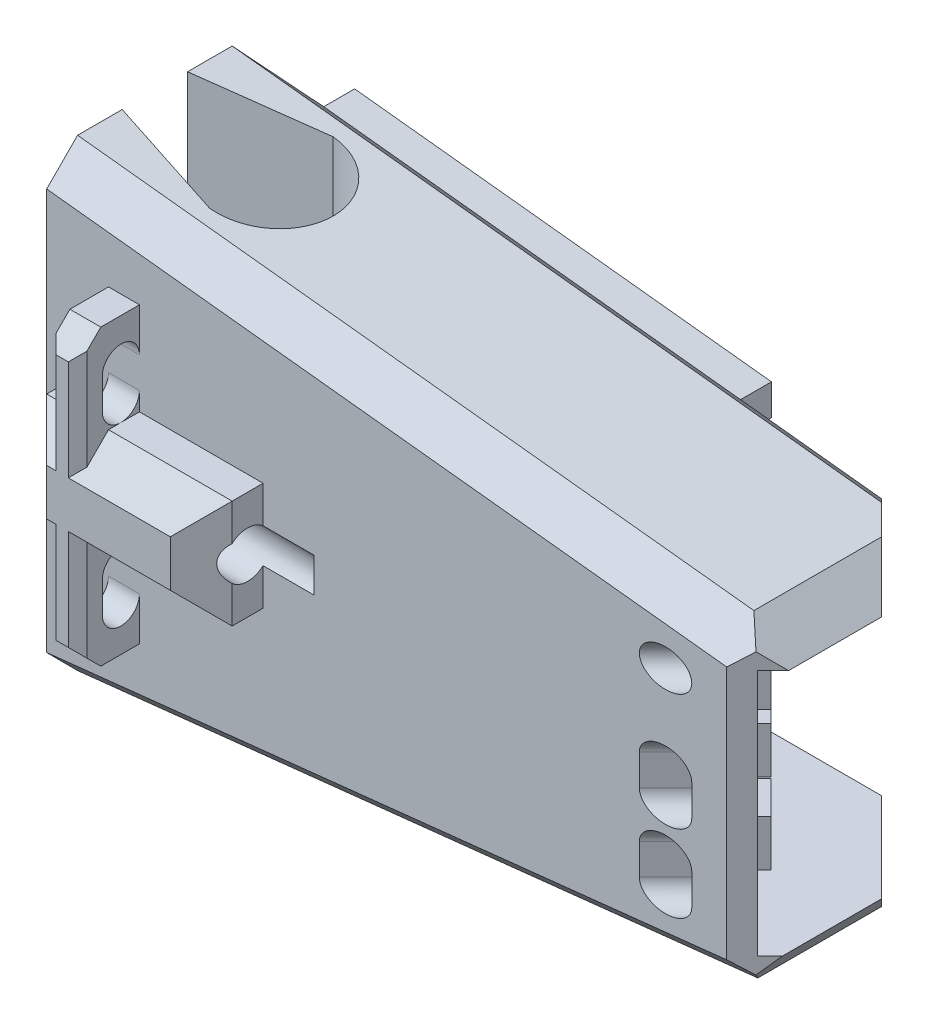
from build123d import *

# Parameters (mm, degrees)
BOSS_EXTRUDE1_DEPTH      = 7
CHAMFER1_SIZE            = 1
CHAMFER7_SIZE            = 1
CHAMFER7_EDGE_2_SIZE     = 1
CHAMFER7_EDGE_2_SIZE2    = 1.128559542
CHAMFER7_EDGE_3_SIZE     = 1
CHAMFER7_EDGE_4_SIZE     = 1
CHAMFER7_EDGE_4_SIZE2    = 1.128559542
CHAMFER14_SIZE           = 1
CHAMFER14_SIZE2          = 1.962610506
SKETCH13_W               = 6
SKETCH13_H               = 3.5
BOSS_EXTRUDE4_DEPTH      = 2
CUT_EXTRUDE9_DEPTH       = 2
CUT_EXTRUDE9_DEPTH_BACK  = 7.647280269
SKETCH14_R               = 0.75
CHAMFER15_SIZE           = 1
SKETCH15_W               = 4
SKETCH15_H               = 3.5
BOSS_EXTRUDE6_DEPTH      = 2
CUT_EXTRUDE10_DEPTH      = 2
CUT_EXTRUDE10_DEPTH_BACK = 6
SKETCH18_R               = 0.75
CHAMFER16_SIZE           = 1
CUT_EXTRUDE12_START      = 3.5
CUT_EXTRUDE12_DEPTH      = 8
SKETCH23_W               = 1.5
SKETCH23_H               = 1.5
BOSS_EXTRUDE7_DEPTH      = 0.3
SKETCH30_W               = 1
SKETCH30_H               = 4
BOSS_EXTRUDE12_DEPTH     = 2
CHAMFER19_SIZE           = 0.3
CHAMFER20_SIZE           = 0.75
CUT_EXTRUDE31_DEPTH      = 1
CUT_EXTRUDE31_DEPTH_BACK = 3
SKETCH33_R               = 0.6
CUT_EXTRUDE32_DEPTH      = 1.23
CUT_EXTRUDE33_REACH      = 30.896
CUT_EXTRUDE34_DEPTH      = 10
CUT_EXTRUDE34_DEPTH_BACK = 2
BOSS_EXTRUDE13_DEPTH     = 1
CUT_EXTRUDE35_DEPTH      = 1


# Read off the part's stored shape, not the designer's step: Cut-Extrude12
with BuildPart() as part:
    # Sketch2 → Boss-Extrude1 (new body)
    with BuildSketch(Plane.XY):
        Polygon((0, 0), (0, 15), (23, 12.5), (23, 2.5), align=None)
    extrude(amount=BOSS_EXTRUDE1_DEPTH)

    # Chamfer1
    chamfer1_edges = [part.edges().sort_by_distance(p)[0] for p in [
        (11.5, 13.75, 7),
        (11.5, 1.25, 7),
        (11.5, 13.75, 0),
        (11.5, 1.25, 0),
    ]]
    chamfer(chamfer1_edges, length=CHAMFER1_SIZE)

    # Chamfer7
    chamfer7_edges = [part.edges().sort_by_distance(p)[0] for p in [
        (23, 7.5, 7),
    ]]
    chamfer(chamfer7_edges, length=CHAMFER7_SIZE)

    # Chamfer7 edge 2
    chamfer7_edge_2_edges = [part.edges().sort_by_distance(p)[0] for p in [
        (23, 2.5, 3.5),
    ]]
    chamfer7_edge_2_side = [part.faces().sort_by_distance(p)[0] for p in [
        (11.5, 1.25, 3.5),
    ]]
    chamfer(chamfer7_edge_2_edges, length=CHAMFER7_EDGE_2_SIZE, length2=CHAMFER7_EDGE_2_SIZE2, reference=chamfer7_edge_2_side[0])

    # Chamfer7 edge 3
    chamfer7_edge_3_edges = [part.edges().sort_by_distance(p)[0] for p in [
        (23, 7.5, 0),
    ]]
    chamfer(chamfer7_edge_3_edges, length=CHAMFER7_EDGE_3_SIZE)

    # Chamfer7 edge 4
    chamfer7_edge_4_edges = [part.edges().sort_by_distance(p)[0] for p in [
        (23, 12.5, 3.5),
    ]]
    chamfer7_edge_4_side = [part.faces().sort_by_distance(p)[0] for p in [
        (23, 7.5, 3.5),
    ]]
    chamfer(chamfer7_edge_4_edges, length=CHAMFER7_EDGE_4_SIZE, length2=CHAMFER7_EDGE_4_SIZE2, reference=chamfer7_edge_4_side[0])

    # Chamfer14
    chamfer14_edges = [part.edges().sort_by_distance(p)[0] for p in [
        (0, 7.5, 0),
    ]]
    chamfer14_side = [part.faces().sort_by_distance(p)[0] for p in [
        (0, 7.5, 3.5),
    ]]
    chamfer(chamfer14_edges, length=CHAMFER14_SIZE, length2=CHAMFER14_SIZE2, reference=chamfer14_side[0])

    # Sketch13 → Boss-Extrude4 (add)
    with BuildSketch(Plane.XY.offset(7)):
        with Locations((4, 7.5)):
            Rectangle(SKETCH13_W, SKETCH13_H)
    extrude(amount=BOSS_EXTRUDE4_DEPTH)

    # Sketch14 → Cut-Extrude9 (cut, two sides: drawn at the far end of the back side and taken through both)
    with BuildSketch(Plane.ZY.offset(-1).offset(-CUT_EXTRUDE9_DEPTH_BACK)):
        with Locations(Location((7.5, 7.5, 0), (0, 0, 131.810314896))):
            Circle(SKETCH14_R)
    extrude(amount=CUT_EXTRUDE9_DEPTH + CUT_EXTRUDE9_DEPTH_BACK, mode=Mode.SUBTRACT)

    # Chamfer15
    # the kernel refuses this chamfer: 1 mm, written as the material it takes off along each edge
    with BuildSketch(Plane(origin=(7, 3.178317012, 9), x_dir=(0.027495876610586487, 0, -0.9996219169112968), z_dir=(0, 1, 0)), Plane(origin=(1, 11.821682988, 9), x_dir=(-0.02749587661058638, 0, -0.9996219169112968), z_dir=(0, -1, 0))) as chamfer15_piece_1:
        Polygon((CHAMFER15_SIZE * 0.999621916911, CHAMFER15_SIZE * 0.0274958766106), (-CHAMFER15_SIZE * 0.0274958766106, CHAMFER15_SIZE * 0.999621916911), (0, 0), align=None)
    extrude(amount=8.643365976, mode=Mode.SUBTRACT)
    with BuildSketch(Plane(origin=(9.571682988, 9.25, 9), x_dir=(0, 0.027495876610585623, -0.9996219169112968), z_dir=(-1, 0, 0)), Plane(origin=(-1.571682988, 5.75, 9), x_dir=(0, -0.027495876610586487, -0.9996219169112968), z_dir=(1, 0, 0))) as chamfer15_piece_2:
        Polygon((CHAMFER15_SIZE * 0.999621916911, CHAMFER15_SIZE * 0.0274958766106), (-CHAMFER15_SIZE * 0.0274958766106, CHAMFER15_SIZE * 0.999621916911), (0, 0), align=None)
    extrude(amount=11.143365976, mode=Mode.SUBTRACT)

    # Sketch15 → Boss-Extrude6 (add)
    with BuildSketch(Plane(origin=(0, 0, 0), x_dir=(-1, 0, 0), z_dir=(0, 0, -1))):
        with Locations((-4.962610506, 7.5)):
            Rectangle(SKETCH15_W, SKETCH15_H)
    extrude(amount=BOSS_EXTRUDE6_DEPTH)

    # Sketch18 → Cut-Extrude10 (cut, two sides: drawn at the far end of the back side and taken through both)
    with BuildSketch(Plane.ZY.offset(-2.962610506).offset(-CUT_EXTRUDE10_DEPTH_BACK)):
        with Locations(Location((-0.5, 7.5, 0), (0, 0, 48.189685104))):
            Circle(SKETCH18_R)
    extrude(amount=CUT_EXTRUDE10_DEPTH + CUT_EXTRUDE10_DEPTH_BACK, mode=Mode.SUBTRACT)

    # Chamfer16
    # the kernel refuses this chamfer: 1 mm, written as the material it takes off along each edge
    with BuildSketch(Plane(origin=(6.962610506, 3.178317012, -2), x_dir=(0.027495876610586487, 0, 0.9996219169112968), z_dir=(0, 1, 0)), Plane(origin=(2.962610506, 11.821682988, -2), x_dir=(-0.027495876610586487, 0, 0.9996219169112968), z_dir=(0, -1, 0))) as chamfer16_piece_1:
        Polygon((CHAMFER16_SIZE * 0.999621916911, -CHAMFER16_SIZE * 0.0274958766106), (-CHAMFER16_SIZE * 0.0274958766106, -CHAMFER16_SIZE * 0.999621916911), (0, 0), align=None)
    extrude(amount=8.643365976, mode=Mode.SUBTRACT)
    with BuildSketch(Plane(origin=(0.390927518, 5.75, -2), x_dir=(0, -0.027495876610586487, 0.9996219169112968), z_dir=(1, 0, 0)), Plane(origin=(9.534293493, 9.25, -2), x_dir=(0, 0.027495876610585623, 0.9996219169112968), z_dir=(-1, 0, 0))) as chamfer16_piece_2:
        Polygon((CHAMFER16_SIZE * 0.999621916911, -CHAMFER16_SIZE * 0.0274958766106), (-CHAMFER16_SIZE * 0.0274958766106, -CHAMFER16_SIZE * 0.999621916911), (0, 0), align=None)
    extrude(amount=9.143365976, mode=Mode.SUBTRACT)

    # Cut-Extrude12 outline → Cut-Extrude12 (cut)
    with BuildSketch(Plane(origin=(0, 0, 0), x_dir=(1, 0, 0), z_dir=(0, 1, 0)).offset(CUT_EXTRUDE12_START)):
        Polygon((22, 0), (16.005327865, 0), (16.005327865, -0.005327865), (22.5, -6.5), (23, -6), (23, -1), align=None)
    extrude(amount=CUT_EXTRUDE12_DEPTH, mode=Mode.SUBTRACT)

    # Sketch23 → Boss-Extrude7 (add)
    with BuildSketch(Plane(origin=(8, 0, -8), x_dir=(-0.7071067811865476, 0, -0.7071067811865476), z_dir=(0.7071067811865476, 0, -0.7071067811865476))):
        with Locations((-14.071243238, 5.25)):
            Rectangle(SKETCH23_W, SKETCH23_H)
        with Locations((-14.071243238, 9.75)):
            Rectangle(SKETCH23_W, SKETCH23_H)
        with Locations((-17.756096654, 5.25)):
            Rectangle(SKETCH23_W, SKETCH23_H)
        with Locations((-17.756096654, 9.75)):
            Rectangle(SKETCH23_W, SKETCH23_H)
    extrude(amount=BOSS_EXTRUDE7_DEPTH)

    # Sketch30 → Boss-Extrude12 (add)
    with BuildSketch(Plane.XY.offset(7)):
        with Locations((2.5, 10.25)):
            Rectangle(SKETCH30_W, SKETCH30_H)
        with Locations((2.5, 4.75)):
            Rectangle(SKETCH30_W, SKETCH30_H)
    extrude(amount=BOSS_EXTRUDE12_DEPTH)

    # Chamfer19
    # the kernel refuses this chamfer: 0.3 mm, written as the material it takes off along each edge
    with BuildSketch(Plane(origin=(2, 8.25, 9), x_dir=(-0.027495876610586622, 0, -0.9996219169112968), z_dir=(0, 1, 0))) as chamfer19_piece_1_section:
        Polygon((CHAMFER19_SIZE * 0.999621916911, -CHAMFER19_SIZE * 0.0274958766106), (-CHAMFER19_SIZE * 0.0274958766106, -CHAMFER19_SIZE * 0.999621916911), (0, 0), align=None)
    chamfer19_piece_1 = extrude(amount=4.771504896, mode=Mode.PRIVATE)
    chamfer19_piece_1 = split(chamfer19_piece_1, bisect_by=Plane(origin=(2.100641026, 9.324038462, 7.925961538), z_dir=(0, 0.7071067811862649, 0.7071067811868302)), keep=Keep.TOP, mode=Mode.PRIVATE)
    add(chamfer19_piece_1, mode=Mode.SUBTRACT)
    with BuildSketch(Plane(origin=(3, 13.021504896, 9), x_dir=(0.027495876610585904, 0, -0.9996219169112968), z_dir=(0, -1, 0))) as chamfer19_piece_2_section:
        Polygon((CHAMFER19_SIZE * 0.999621916911, -CHAMFER19_SIZE * 0.0274958766106), (-CHAMFER19_SIZE * 0.0274958766106, -CHAMFER19_SIZE * 0.999621916911), (0, 0), align=None)
    chamfer19_piece_2 = extrude(amount=5.543009793, mode=Mode.PRIVATE)
    chamfer19_piece_2 = split(chamfer19_piece_2, bisect_by=Plane(origin=(2.899358974, 9.324038462, 7.925961538), z_dir=(0, 0.7071067811862649, 0.7071067811868302)), keep=Keep.TOP, mode=Mode.PRIVATE)
    add(chamfer19_piece_2, mode=Mode.SUBTRACT)
    with BuildSketch(Plane(origin=(2, 1.978495104, 9), x_dir=(-0.027495876610586622, 0, -0.9996219169112968), z_dir=(0, 1, 0))) as chamfer19_piece_3_section:
        Polygon((CHAMFER19_SIZE * 0.999621916911, -CHAMFER19_SIZE * 0.0274958766106), (-CHAMFER19_SIZE * 0.0274958766106, -CHAMFER19_SIZE * 0.999621916911), (0, 0), align=None)
    chamfer19_piece_3 = extrude(amount=4.771504896, mode=Mode.PRIVATE)
    chamfer19_piece_3 = split(chamfer19_piece_3, bisect_by=Plane(origin=(2.100641026, 5.675961538, 7.925961538), z_dir=(0, -0.7071067811862649, 0.7071067811868302)), keep=Keep.TOP, mode=Mode.PRIVATE)
    add(chamfer19_piece_3, mode=Mode.SUBTRACT)
    with BuildSketch(Plane(origin=(3, 7.521504896, 9), x_dir=(0.027495876610585904, 0, -0.9996219169112968), z_dir=(0, -1, 0))) as chamfer19_piece_4_section:
        Polygon((CHAMFER19_SIZE * 0.999621916911, -CHAMFER19_SIZE * 0.0274958766106), (-CHAMFER19_SIZE * 0.0274958766106, -CHAMFER19_SIZE * 0.999621916911), (0, 0), align=None)
    chamfer19_piece_4 = extrude(amount=5.543009793, mode=Mode.PRIVATE)
    chamfer19_piece_4 = split(chamfer19_piece_4, bisect_by=Plane(origin=(2.899358974, 5.675961538, 7.925961538), z_dir=(0, -0.7071067811862649, 0.7071067811868302)), keep=Keep.TOP, mode=Mode.PRIVATE)
    add(chamfer19_piece_4, mode=Mode.SUBTRACT)

    # Chamfer20
    chamfer20_edges = [part.edges().sort_by_distance(p)[0] for p in [
        (2.5, 2.75, 9),
        (2.5, 12.25, 9),
    ]]
    chamfer(chamfer20_edges, length=CHAMFER20_SIZE)

    # Sketch33 → Cut-Extrude31 (cut, two sides: drawn at the far end of the back side and taken through both)
    with BuildSketch(Plane(origin=(8, 0, -8), x_dir=(-0.7071067811865476, 0, -0.7071067811865476), z_dir=(0.7071067811865476, 0, -0.7071067811865476)).offset(-CUT_EXTRUDE31_DEPTH_BACK)):
        with Locations((-19.106096654, 10.58)):
            Circle(SKETCH33_R)
        with BuildLine():
            Line((-18.506096654, 7.8), (-18.506096654, 6.8))
            ThreePointArc((-18.506096654, 6.8), (-19.106096654, 6.2), (-19.706096654, 6.8))
            Line((-19.706096654, 6.8), (-19.706096654, 7.8))
            ThreePointArc((-19.706096654, 7.8), (-19.106096654, 8.4), (-18.506096654, 7.8))
        make_face()
        with BuildLine():
            Line((-18.506096654, 5.3), (-18.506096654, 4.3))
            ThreePointArc((-18.506096654, 4.3), (-19.106096654, 3.7), (-19.706096654, 4.3))
            Line((-19.706096654, 4.3), (-19.706096654, 5.3))
            ThreePointArc((-19.706096654, 5.3), (-19.106096654, 5.9), (-18.506096654, 5.3))
        make_face()
    extrude(amount=CUT_EXTRUDE31_DEPTH + CUT_EXTRUDE31_DEPTH_BACK, mode=Mode.SUBTRACT)

    # Sketch35 → Cut-Extrude32 (cut)
    with BuildSketch(Plane.ZY.offset(-2)):
        with BuildLine():
            Line((8.2, 10.85), (8.2, 9.85))
            ThreePointArc((8.2, 9.85), (7.6, 9.25), (7, 9.85))
            Line((7, 9.85), (7, 10.85))
            ThreePointArc((7, 10.85), (7.6, 11.45), (8.2, 10.85))
        make_face()
        with BuildLine():
            Line((8.2, 5.15), (8.2, 4.15))
            ThreePointArc((8.2, 4.15), (7.6, 3.55), (7, 4.15))
            Line((7, 4.15), (7, 5.15))
            ThreePointArc((7, 5.15), (7.6, 5.75), (8.2, 5.15))
        make_face()
    extrude(amount=-CUT_EXTRUDE32_DEPTH, mode=Mode.SUBTRACT)

    # Cut-Extrude33: up to this plane
    cut_extrude33_end = Plane(origin=(0, 15, 7), z_dir=(-0.10805918076841893, -0.9941444630694567, 0))
    # Sketch36 → Cut-Extrude33 (cut, up to the surface)
    with BuildSketch(Plane(origin=(0, 0, 0), x_dir=(0, 0, -1), z_dir=(0, 1, 0)), mode=Mode.PRIVATE) as cut_extrude33_sk1:
        with BuildLine():
            Line((-1.735294118, -2.828823529), (-3, 2.23))
            Line((-3, 2.23), (-4, 2.23))
            Line((-4, 2.23), (-5.264705882, -2.828823529))
            ThreePointArc((-5.264705882, -2.828823529), (-3.5, -1.77), (-1.735294118, -2.828823529))
        make_face()
    cut_extrude33_tool1 = split(extrude(cut_extrude33_sk1.sketch, amount=CUT_EXTRUDE33_REACH, mode=Mode.PRIVATE), bisect_by=cut_extrude33_end, keep=Keep.BOTH, mode=Mode.PRIVATE)
    add(cut_extrude33_tool1.solids().sort_by_distance((0.278692, 0, 3.5))[0], mode=Mode.SUBTRACT)
    # Sketch36 → Cut-Extrude33 (cut, up to the surface)
    with BuildSketch(Plane(origin=(0, 0, 0), x_dir=(0, 0, -1), z_dir=(0, 1, 0)), mode=Mode.PRIVATE) as cut_extrude33_sk2:
        with BuildLine():
            Line((-1.5, -3.77), (-1.735294118, -2.828823529))
            ThreePointArc((-1.735294118, -2.828823529), (-3.5, -1.77), (-5.264705882, -2.828823529))
            Line((-5.264705882, -2.828823529), (-5.5, -3.77))
            ThreePointArc((-5.5, -3.77), (-3.5, -5.77), (-1.5, -3.77))
        make_face()
    cut_extrude33_tool2 = split(extrude(cut_extrude33_sk2.sketch, amount=CUT_EXTRUDE33_REACH, mode=Mode.PRIVATE), bisect_by=cut_extrude33_end, keep=Keep.BOTH, mode=Mode.PRIVATE)
    add(cut_extrude33_tool2.solids().sort_by_distance((3.772955, 0, 3.5))[0], mode=Mode.SUBTRACT)

    # Sketch37 → Cut-Extrude34 (cut, two sides: drawn at the far end of the back side and taken through both)
    with BuildSketch(Plane.XZ.offset(-11.5).offset(-CUT_EXTRUDE34_DEPTH_BACK)):
        Polygon((23, 3), (20, 0), (23, 0), align=None)
    extrude(amount=CUT_EXTRUDE34_DEPTH + CUT_EXTRUDE34_DEPTH_BACK, mode=Mode.SUBTRACT)

    # Sketch38 → Boss-Extrude13 (add)
    with BuildSketch(Plane(origin=(0, 0, 0), x_dir=(-1, 0, 0), z_dir=(0, 0, -1))):
        Polygon((-2.962610506, 8.654508497), (-1.962610506, 8.654508497), (-1.962610506, 13.780782745), (-15.446112906, 12.315184658), (-15.446112906, 11.309294632), (-2.962610506, 12.666197067), align=None)
        Polygon((-2.962610506, 6.345491503), (-1.962610506, 6.345491503), (-1.962610506, 1.219217255), (-15.436151057, 2.683732532), (-15.436151057, 3.689622559), (-2.962610506, 2.333802933), align=None)
    extrude(amount=BOSS_EXTRUDE13_DEPTH)

    # Sketch39 → Cut-Extrude35 (cut)
    with BuildSketch(Plane(origin=(0, 0, 0), x_dir=(-1, 0, 0), z_dir=(0, 0, -1))):
        with BuildLine():
            Line((-14.642674888, 11.077060629), (-12.388868113, 11.077060629))
            ThreePointArc((-12.388868113, 11.077060629), (-11.888868113, 10.577060629), (-12.388868113, 10.077060629))
            Line((-12.388868113, 10.077060629), (-14.642674888, 10.077060629))
            ThreePointArc((-14.642674888, 10.077060629), (-15.142674888, 10.577060629), (-14.642674888, 11.077060629))
        make_face()
        with BuildLine():
            Line((-14.642674888, 4.993835409), (-12.388868113, 4.993835409))
            ThreePointArc((-12.388868113, 4.993835409), (-11.888868113, 4.493835409), (-12.388868113, 3.993835409))
            Line((-12.388868113, 3.993835409), (-14.642674888, 3.993835409))
            ThreePointArc((-14.642674888, 3.993835409), (-15.142674888, 4.493835409), (-14.642674888, 4.993835409))
        make_face()
        with BuildLine():
            Line((-6.641269667, 4.993835409), (-4.387462892, 4.993835409))
            ThreePointArc((-4.387462892, 4.993835409), (-3.887462892, 4.493835409), (-4.387462892, 3.993835409))
            Line((-4.387462892, 3.993835409), (-6.641269667, 3.993835409))
            ThreePointArc((-6.641269667, 3.993835409), (-7.141269667, 4.493835409), (-6.641269667, 4.993835409))
        make_face()
        with BuildLine():
            Line((-6.641269667, 11.077060629), (-4.387462892, 11.077060629))
            ThreePointArc((-4.387462892, 11.077060629), (-3.887462892, 10.577060629), (-4.387462892, 10.077060629))
            Line((-4.387462892, 10.077060629), (-6.641269667, 10.077060629))
            ThreePointArc((-6.641269667, 10.077060629), (-7.141269667, 10.577060629), (-6.641269667, 11.077060629))
        make_face()
    extrude(amount=-CUT_EXTRUDE35_DEPTH, mode=Mode.SUBTRACT)


solid = part.part
